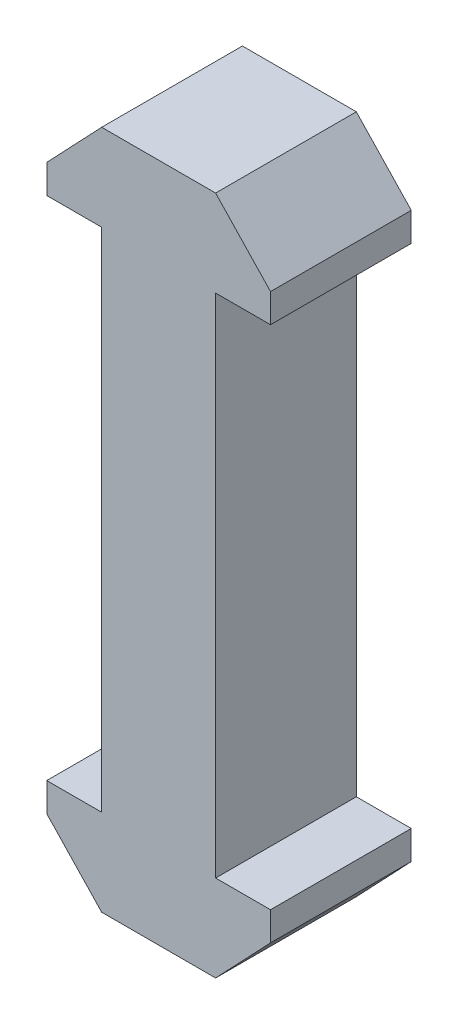
from build123d import *

# Parameters (mm, degrees)
BOSS_EXTRUDE1_DEPTH = 5


with BuildPart() as part:
    # Sketch1 → Boss-Extrude1 (new, symmetric)
    with BuildSketch(Plane.XY):
        Polygon((7.95, 0), (4.05, 0), (4.05, 36), (7.95, 36), (7.95, 38.04), (4.048, 42.152414984), (-4.048, 42.152414984), (-7.95, 38.04), (-7.95, 36), (-4.05, 36), (-4.05, 0), (-7.95, 0), (-7.95, -2.04), (-4.048, -6.152414984), (4.048, -6.152414984), (7.95, -2.04), align=None)
    extrude(amount=BOSS_EXTRUDE1_DEPTH, both=True)


solid = part.part
